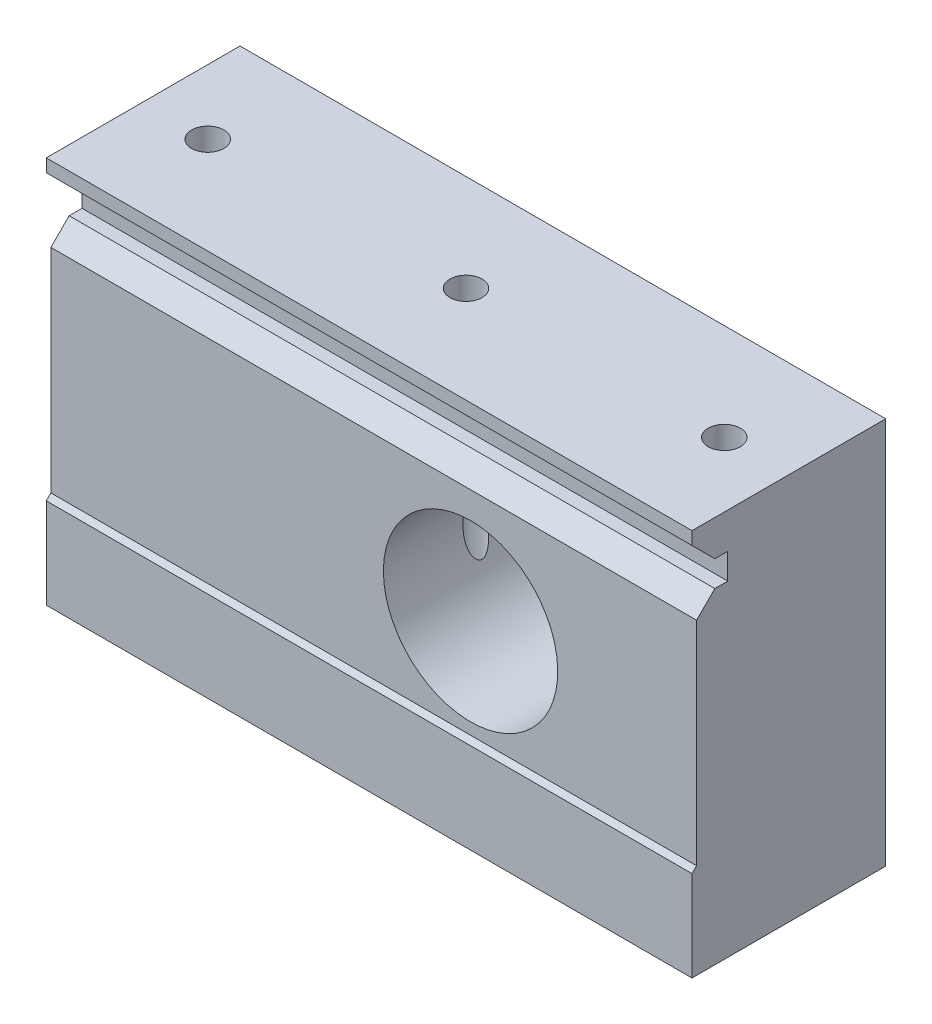
from build123d import *

# Parameters (mm, degrees)
SKETCH1_W              = 100
SKETCH1_H              = 60
BOSS_EXTRUDE1_DEPTH    = 30
CUT_EXTRUDE1_DEPTH     = 110
SKETCH_1_R             = 2.493332764
CUT_EXTRUDE_1_DEPTH    = 100
PATTERN_LINEAR_1_COUNT = 3
PATTERN_LINEAR_1_PITCH = 40
SKETCH_2_R             = 13.5
CUT_EXTRUDE_2_DEPTH    = 100


with BuildPart() as part:
    # Sketch1 → Boss-Extrude1 (new body)
    with BuildSketch(Plane.XY):
        with Locations((2.079207921, -0.485148515)):
            Rectangle(SKETCH1_W, SKETCH1_H)
    extrude(amount=BOSS_EXTRUDE1_DEPTH)

    # Sketch3 → Cut-Extrude1 (cut)
    with BuildSketch(Plane.ZY.offset(47.920792079)):
        Polygon((30, -30.485148515), (30, -16.485148515), (29.292893219, -15.778041734), (29.292893219, 17.150890454), (26.464466094, 19.979317579), (24.464466094, 19.979317579), (24.464466094, 23.979317579), (26.464466094, 23.979317579), (30, 27.514851485), (30, 29.514851485), (35.630972976, 28.601630178), (37.149112702, -26.247837132), align=None)
    extrude(amount=-CUT_EXTRUDE1_DEPTH, mode=Mode.SUBTRACT)

    # Эскиз1 → Вырез-Вытянуть1 (cut)
    with BuildSketch(Plane(origin=(0, 29.514851485, 0), x_dir=(1, 0, 0), z_dir=(0, 1, 0))):
        with Locations((42.079207921, -15)):
            Circle(SKETCH_1_R)
    cut_extrude_1 = extrude(amount=-CUT_EXTRUDE_1_DEPTH, mode=Mode.SUBTRACT)

    # Линейный массив1: Вырез-Вытянуть1 ×3
    with Locations(*[(-i * PATTERN_LINEAR_1_PITCH, 0, 0) for i in range(1, PATTERN_LINEAR_1_COUNT)]):
        add(cut_extrude_1, mode=Mode.SUBTRACT)

    # Эскиз2 → Вырез-Вытянуть2 (cut)
    with BuildSketch(Plane(origin=(0, 0, 0), x_dir=(-1, 0, 0), z_dir=(0, 0, -1))):
        with Locations((-17.079207921, -0.485148515)):
            Circle(SKETCH_2_R)
    extrude(amount=-CUT_EXTRUDE_2_DEPTH, mode=Mode.SUBTRACT)


solid = part.part
